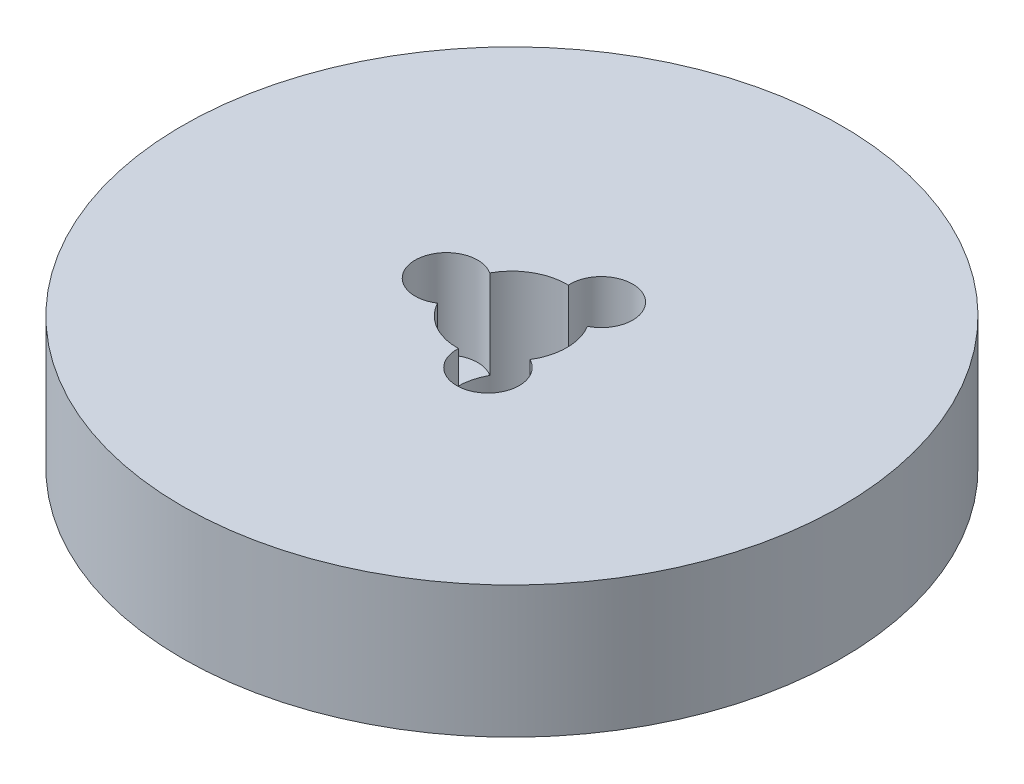
from build123d import *

# Parameters (mm, degrees)
SKETCH1_R           = 60
BOSS_EXTRUDE1_DEPTH = 24
SKETCH2_R           = 10
CUT_EXTRUDE1_DEPTH  = 89.18163074
SKETCH3_R           = 5.695747902
CUT_EXTRUDE2_DEPTH  = 16.15301458
CIRPATTERN1_COUNT   = 3


with BuildPart() as part:
    # Sketch1 → Boss-Extrude1 (new body)
    with BuildSketch(Plane(origin=(0, 0, 0), x_dir=(1, 0, 0), z_dir=(0, 1, 0))):
        Circle(SKETCH1_R)
    extrude(amount=BOSS_EXTRUDE1_DEPTH)

    # Sketch2 → Cut-Extrude1 (cut, through all)
    with BuildSketch(Plane(origin=(0, 0, 0), x_dir=(1, 0, 0), z_dir=(0, 1, 0))):
        Circle(SKETCH2_R)
    extrude(amount=CUT_EXTRUDE1_DEPTH, mode=Mode.SUBTRACT)

    # Sketch3 → Cut-Extrude2 (cut)
    with BuildSketch(Plane(origin=(0, 24, 0), x_dir=(1, 0, 0), z_dir=(0, 1, 0))):
        with Locations((-11.920823607, 0)):
            Circle(SKETCH3_R)
    cut_extrude2 = extrude(amount=-CUT_EXTRUDE2_DEPTH, mode=Mode.SUBTRACT)

    # CirPattern1: Cut-Extrude2 ×3 about axis
    cirpattern1_axis = Axis((0, 0, 0), (0, 1, 0))
    for i in range(1, CIRPATTERN1_COUNT):
        add(cut_extrude2.rotate(cirpattern1_axis, i * 360 / CIRPATTERN1_COUNT), mode=Mode.SUBTRACT)


solid = part.part
